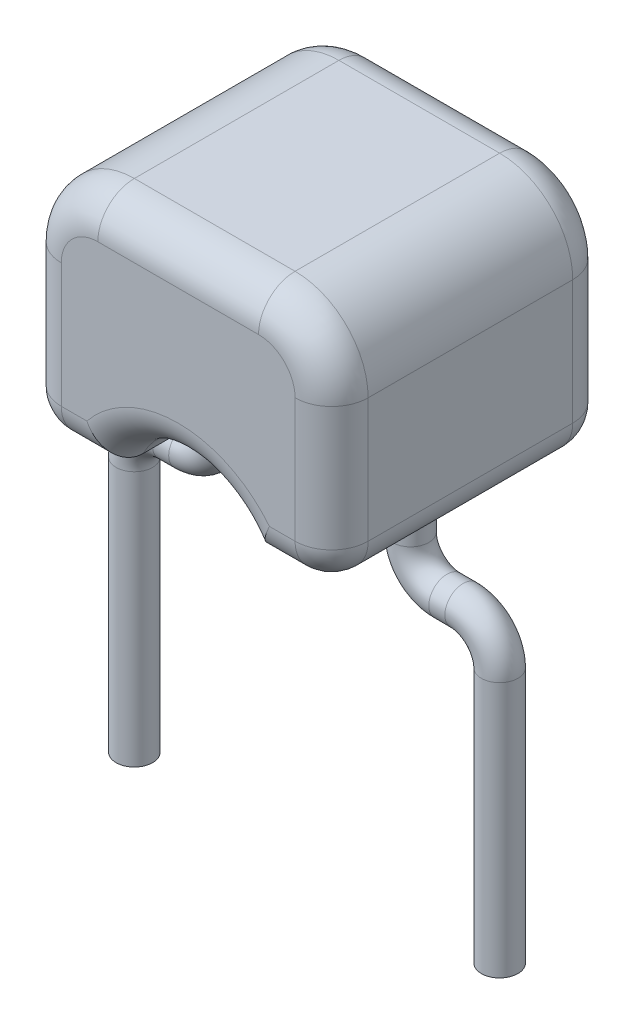
from build123d import *

# Parameters (mm, degrees)
SKETCH_1_W               = 4.2
SKETCH_1_H               = 3.2
EXTRUDE_1_DEPTH          = 3.8
CUT_EXTRUDE_1_DEPTH      = 5.627094121
CUT_EXTRUDE_1_DEPTH_BACK = 5.627094121
SKETCH_2_R               = 1.1
FILLET_1_R               = 1
FILLET_2_R               = 0.5
FILLET_3_R               = 0.5
SWEEP_1_PROFILE_R        = 0.25
SWEEP_2_OUTLINE_R        = 0.25
SWEEP_2_ANGLE            = 90
SWEEP_2_2_OUTLINE_R      = 0.25
SWEEP_2_2_ANGLE          = 90
SWEEP_START              = 1.779795797
SWEEP_2_3_OUTLINE_R      = 0.25
SWEEP_2_3_DEPTH          = 0.220204303
SWEEP_START_2            = -2.1000001
SWEEP_2_4_OUTLINE_R      = 0.25
SWEEP_2_4_DEPTH          = 1.1000001
SWEEP_START_3            = -6.6
SWEEP_2_5_OUTLINE_R      = 0.25
SWEEP_2_5_DEPTH          = 3.5000001


with BuildPart() as part:
    # Эскиз1 → Бобышка-Вытянуть1 (new body)
    with BuildSketch(Plane.XY):
        Rectangle(SKETCH_1_W, SKETCH_1_H)
    extrude(amount=EXTRUDE_1_DEPTH)

    # Эскиз2 → Вырез-Вытянуть1 (cut, two sides: drawn at the far end of the back side and taken through both)
    with BuildSketch(Plane.XY.offset(3.8).offset(-CUT_EXTRUDE_1_DEPTH_BACK)):
        with Locations((0, -2.1)):
            Circle(SKETCH_2_R)
    extrude(amount=CUT_EXTRUDE_1_DEPTH + CUT_EXTRUDE_1_DEPTH_BACK, mode=Mode.SUBTRACT)

    # Скругление1
    fillet_1_edges = [part.edges().sort_by_distance(p)[0] for p in [
        (-2.1, 1.6, 1.9),
        (2.1, 1.6, 1.9),
    ]]
    fillet(fillet_1_edges, radius=FILLET_1_R)

    # Скругление2
    fillet_2_edges = [part.edges().sort_by_distance(p)[0] for p in [
        (2.1, -1.6, 1.9),
        (-2.1, -1.6, 1.9),
    ]]
    fillet(fillet_2_edges, radius=FILLET_2_R)

    # Скругление3
    fillet_3_edges = [part.edges().sort_by_distance(p)[0] for p in [
        (1.289897949, -1.6, 0),
        (1.289897949, -1.6, 3.8),
        (0, -1, 0),
        (0, -1, 3.8),
        (0, 1.6, 0),
        (0, 1.6, 3.8),
        (-2.1, -0.25, 0),
        (-1.807106781, 1.307106781, 0),
        (1.807106781, 1.307106781, 0),
        (-2.1, -0.25, 3.8),
        (-1.807106781, 1.307106781, 3.8),
        (1.807106781, 1.307106781, 3.8),
        (2.1, -0.25, 0),
        (2.1, -0.25, 3.8),
        (-1.289897949, -1.6, 0),
        (-1.953553391, -1.453553391, 0),
        (1.953553391, -1.453553391, 0),
        (-1.289897949, -1.6, 3.8),
        (-1.953553391, -1.453553391, 3.8),
        (1.953553391, -1.453553391, 3.8),
    ]]
    fillet(fillet_3_edges, radius=FILLET_3_R)

    # По траектории1: sweep along a curve in space
    with BuildLine() as sweep_1_path:
        Line((-1.279795897, -1.6, 1.9), (-1.279795897, -2.1, 1.9))
        ThreePointArc((-1.279795897, -2.1, 1.9), (-1.426242507, -2.453553391, 1.9), (-1.779795897, -2.6, 1.9))
        Line((-1.779795897, -2.6, 1.9), (-2, -2.6, 1.9))
        ThreePointArc((-2.5, -3.1, 1.9), (-2.353553391, -2.746446609, 1.9), (-2, -2.6, 1.9))
        Line((-2.5, -3.1, 1.9), (-2.5, -6.6, 1.9))
    # По траектории1 profile (on start of the path) → По траектории1 (sweep)
    with BuildSketch(Plane(origin=(-1.279795897, -1.6, 1.9), x_dir=(0, 0, -1), z_dir=(0, -1, 0))):
        Circle(SWEEP_1_PROFILE_R)
    sweep(path=sweep_1_path.line)



with BuildPart() as body_2:
    # По траектории2: read off the stored shape, not the designer's step
    # По траектории2 outline → По траектории2 (revolve)
    with BuildSketch(Plane(origin=(1.779795897, -2.1, 0), x_dir=(-1, 0, 0), z_dir=(0, 1, 0))):
        with Locations((0.5, 1.9)):
            Circle(SWEEP_2_OUTLINE_R)
    revolve(axis=Axis((1.779795897, -2.1, 0), (0, 0, 1)), revolution_arc=SWEEP_2_ANGLE)



with BuildPart() as body_3:
    # Sweep 2 2 outline → Sweep 2 2 (revolve)
    with BuildSketch(Plane(origin=(2, -3.1, 0), x_dir=(1, 0, 0), z_dir=(0, -1, 0))):
        with Locations((0.5, 1.9)):
            Circle(SWEEP_2_2_OUTLINE_R)
    revolve(axis=Axis((2, -3.1, 0), (0, 0, 1)), revolution_arc=SWEEP_2_2_ANGLE)


with BuildPart() as body_2_1:
    add(body_2.part)

    add(body_3.part)  # Sweep 2 3 merges body 3
    # Sweep 2 3 outline → Sweep 2 3 (add)
    with BuildSketch(Plane.YZ.offset(SWEEP_START)):
        with Locations((-2.6, 1.9)):
            Circle(SWEEP_2_3_OUTLINE_R)
    extrude(amount=SWEEP_2_3_DEPTH)


with BuildPart() as part_1:
    add(part.part)

    add(body_2_1.part)  # Sweep 2 4 merges body 2
    # Sweep 2 4 outline → Sweep 2 4 (add)
    with BuildSketch(Plane(origin=(0, 0, 0), x_dir=(1, 0, 0), z_dir=(0, 1, 0)).offset(SWEEP_START_2)):
        with Locations((1.279795897, -1.9)):
            Circle(SWEEP_2_4_OUTLINE_R)
    extrude(amount=SWEEP_2_4_DEPTH)

    # Sweep 2 5 outline → Sweep 2 5 (add)
    with BuildSketch(Plane(origin=(0, 0, 0), x_dir=(1, 0, 0), z_dir=(0, 1, 0)).offset(SWEEP_START_3)):
        with Locations((2.5, -1.9)):
            Circle(SWEEP_2_5_OUTLINE_R)
    extrude(amount=SWEEP_2_5_DEPTH)


solid = part_1.part
